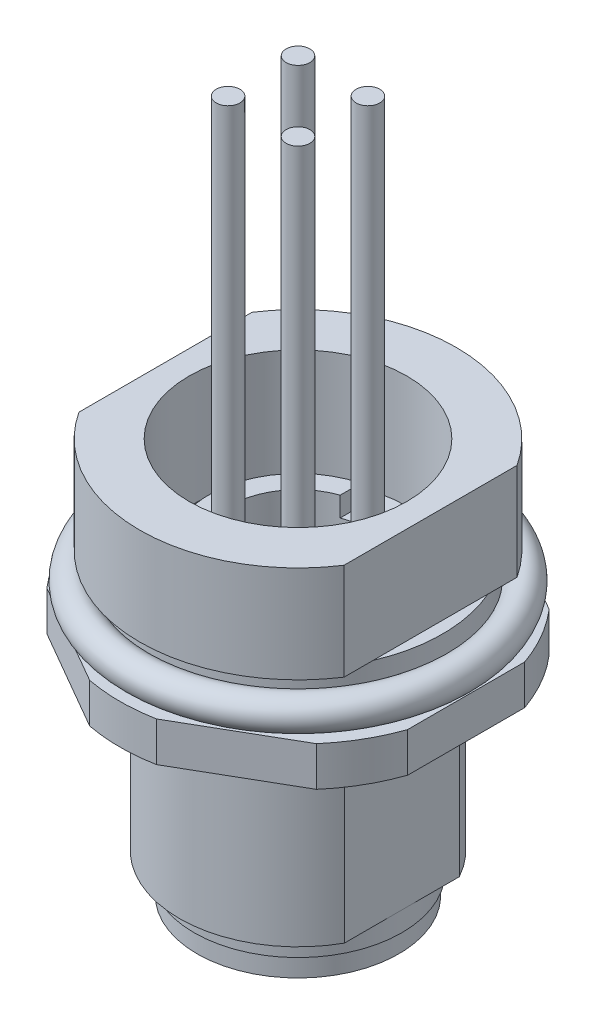
from build123d import *
from build123d.topology import SkipClean

# Parameters (mm, degrees)
BOSS_EXTRUDE2_DEPTH                     = 4.9
BOSS_EXTRUDE3_DEPTH                     = 2
BOSS_EXTRUDE4_DEPTH                     = 9
BOSS_EXTRUDE5_REACH                     = 24.83
SKETCH5_R                               = 5.25
SKETCH6_R                               = 5.1
BOSS_EXTRUDE6_DEPTH                     = 1
F_8_3_8_3_DIAMETER_HOLE1_D              = 8.3
F_8_3_8_3_DIAMETER_HOLE1_DEPTH          = 8
BOSS_EXTRUDE7_DEPTH                     = 7.5
CUT_EXTRUDE1_START                      = -1
CUT_EXTRUDE1_DEPTH                      = 1
CBORE_FOR_M6_HEX_HEAD_BOLT1_D           = 7
CBORE_FOR_M6_HEX_HEAD_BOLT1_DEPTH       = 8.2
CBORE_FOR_M6_HEX_HEAD_BOLT1_CBORE_D     = 11
CBORE_FOR_M6_HEX_HEAD_BOLT1_CBORE_DEPTH = 5.7
BOSS_EXTRUDE8_DEPTH                     = 1
BOSS_EXTRUDE9_DEPTH                     = 1
BOSS_EXTRUDE10_DEPTH                    = 1
BOSS_EXTRUDE14_DEPTH                    = 1
SKETCH21_W                              = 0.6
SKETCH21_H                              = 23.2
SKETCH22_W                              = 0.6
SKETCH22_H                              = 23.2
SKETCH23_W                              = 0.6
SKETCH23_H                              = 23.2
SKETCH24_W                              = 0.6
SKETCH24_H                              = 23.2
FILLET1_R                               = 1.2


with BuildPart() as part:
    # Boss-Extrude1: read off the stored shape, not the designer's step
    # Boss-Extrude1 outline → Boss-Extrude1 (revolve)
    with BuildSketch(Plane.XY):
        with BuildLine():
            ThreePointArc((8.1, 4), (8.665685425, 5.365685425), (7.3, 4.8))
            Line((7.3, 4.8), (7.3, 6.1))
            Line((7.3, 6.1), (0, 6.1))
            Line((0, 6.1), (0, 4))
            Line((0, 4), (8.1, 4))
        make_face()
    revolve(axis=Axis((0, 0, 0), (0, 1, 0)))

    # Sketch2 → Boss-Extrude2 (add)
    with BuildSketch(Plane(origin=(0, 6.1, 0), x_dir=(-1, 0, 0), z_dir=(0, 1, 0))):
        with BuildLine():
            Line((-6.7, -4.371498599), (-6.7, 4.371498599))
            ThreePointArc((-6.7, 4.371498599), (0, 8), (6.7, 4.371498599))
            Line((6.7, 4.371498599), (6.7, -4.371498599))
            ThreePointArc((6.7, -4.371498599), (0, -8), (-6.7, -4.371498599))
        make_face()
    extrude(amount=BOSS_EXTRUDE2_DEPTH)

    # Sketch3 → Boss-Extrude3 (add)
    with BuildSketch(Plane(origin=(0, 4, 0), x_dir=(1, 0, 0), z_dir=(0, 1, 0))):
        with BuildLine():
            Line((1.688262309, -8.840235878), (6.811737691, -5.882195986))
            ThreePointArc((6.811737691, -5.882195986), (7.794228634, -4.5), (8.5, -2.958039892))
            Line((8.5, -2.958039892), (8.5, 2.958039892))
            ThreePointArc((8.5, 2.958039892), (7.794228634, 4.5), (6.811737691, 5.882195986))
            Line((6.811737691, 5.882195986), (1.688262309, 8.840235878))
            ThreePointArc((1.688262309, 8.840235878), (0, 9), (-1.688262309, 8.840235878))
            Line((-1.688262309, 8.840235878), (-6.811737691, 5.882195986))
            ThreePointArc((-6.811737691, 5.882195986), (-7.794228634, 4.5), (-8.5, 2.958039892))
            Line((-8.5, 2.958039892), (-8.5, -2.958039892))
            ThreePointArc((-8.5, -2.958039892), (-7.794228634, -4.5), (-6.811737691, -5.882195986))
            Line((-6.811737691, -5.882195986), (-1.688262309, -8.840235878))
            ThreePointArc((-1.688262309, -8.840235878), (0, -9), (1.688262309, -8.840235878))
        make_face()
    extrude(amount=-BOSS_EXTRUDE3_DEPTH)

    # Sketch4 → Boss-Extrude4 (add)
    with BuildSketch(Plane.XZ.offset(-2)):
        with BuildLine():
            Line((-5.25, -2.90473751), (-5.25, 2.90473751))
            ThreePointArc((-5.25, 2.90473751), (0, 6), (5.25, 2.90473751))
            Line((5.25, 2.90473751), (5.25, -2.90473751))
            ThreePointArc((5.25, -2.90473751), (0, -6), (-5.25, -2.90473751))
        make_face()
    extrude(amount=BOSS_EXTRUDE4_DEPTH)

    # Sketch5 → Boss-Extrude5 (add, up to next)
    with BuildSketch(Plane.XZ.offset(8), mode=Mode.PRIVATE) as boss_extrude5_sk1:
        Circle(SKETCH5_R)
    boss_extrude5_tool1 = extrude(boss_extrude5_sk1.sketch, amount=-BOSS_EXTRUDE5_REACH, mode=Mode.PRIVATE) - part.part
    add(boss_extrude5_tool1.solids().sort_by_distance((0, -8, 0))[0])

    # Sketch6 → Boss-Extrude6 (add)
    with BuildSketch(Plane.XZ.offset(8)):
        with Locations(Location((0, 0, 0), (0, 0, 90))):
            Circle(SKETCH6_R)
    extrude(amount=BOSS_EXTRUDE6_DEPTH)

    # Ø8.3 (8.3) Diameter Hole1
    with Locations(Plane(origin=(0, -9, 0), x_dir=(-1, 0, 0), z_dir=(0, -1, 0))):
        with Locations((0, 0)):
            Hole(F_8_3_8_3_DIAMETER_HOLE1_D / 2, depth=F_8_3_8_3_DIAMETER_HOLE1_DEPTH)

    # Sketch9 → Boss-Extrude7 (add)
    with BuildSketch(Plane.XZ.offset(1)):
        with BuildLine():
            Line((-0.65, 3.3), (-0.65, 4.098780306))
            ThreePointArc((-0.65, 4.098780306), (0, 4.15), (0.65, 4.098780306))
            Line((0.65, 4.098780306), (0.65, 3.3))
            ThreePointArc((0.65, 3.3), (0, 2.65), (-0.65, 3.3))
        make_face()
    extrude(amount=BOSS_EXTRUDE7_DEPTH)

    # Sketch10 → Cut-Extrude1 (cut)
    with SkipClean():  # the faces are left unmerged after this step: merging them gives an invalid solid
        with BuildSketch(Plane.XZ.offset(1).offset(CUT_EXTRUDE1_START)):
            with BuildLine():
                Line((-0.65, 0.65), (-4.098780306, 0.65))
                ThreePointArc((-4.098780306, 0.65), (0, -4.15), (4.098780306, 0.65))
                Line((4.098780306, 0.65), (0.65, 0.65))
                Line((0.65, 0.65), (0.65, 3.3))
                ThreePointArc((0.65, 3.3), (0, 2.65), (-0.65, 3.3))
                Line((-0.65, 3.3), (-0.65, 0.65))
            make_face()
        extrude(amount=CUT_EXTRUDE1_DEPTH, mode=Mode.SUBTRACT)

    # CBORE for M6 Hex Head Bolt1
    with Locations(Plane(origin=(0, 11, 0), x_dir=(1, 0, 0), z_dir=(0, 1, 0))):
        with Locations((0, 0)):
            CounterBoreHole(CBORE_FOR_M6_HEX_HEAD_BOLT1_D / 2, CBORE_FOR_M6_HEX_HEAD_BOLT1_CBORE_D / 2, CBORE_FOR_M6_HEX_HEAD_BOLT1_CBORE_DEPTH, depth=CBORE_FOR_M6_HEX_HEAD_BOLT1_DEPTH)

    # Sketch13 → Boss-Extrude8 (add)
    with BuildSketch(Plane(origin=(0, 5.3, 0), x_dir=(-1, 0, 0), z_dir=(0, 1, 0))):
        with BuildLine():
            Line((-1.166190379, 4.346262762), (-1.166190379, 3.3))
            ThreePointArc((-1.166190379, 3.3), (-3.5, 0), (-1.166190379, -3.3))
            Line((-1.166190379, -3.3), (-1.166190379, -4.346262762))
            ThreePointArc((-1.166190379, -4.346262762), (-4.5, 0), (-1.166190379, 4.346262762))
        make_face()
    extrude(amount=BOSS_EXTRUDE8_DEPTH)

    # Sketch14 → Boss-Extrude9 (add)
    with SkipClean():  # the faces are left unmerged after this step: merging them gives an invalid solid
        with BuildSketch(Plane(origin=(0, 5.3, 0), x_dir=(-1, 0, 0), z_dir=(0, 1, 0))):
            with BuildLine():
                Line((1.166190379, -4.346262762), (1.166190379, -3.3))
                ThreePointArc((1.166190379, -3.3), (3.5, 0), (1.166190379, 3.3))
                Line((1.166190379, 3.3), (1.166190379, 4.346262762))
                ThreePointArc((1.166190379, 4.346262762), (4.5, 0), (1.166190379, -4.346262762))
            make_face()
        extrude(amount=BOSS_EXTRUDE9_DEPTH)
    add(part.part.scale(1), mode=Mode.REPLACE)  # the faces are merged on a copy

    # Sketch15 → Boss-Extrude10 (add)
    with BuildSketch(Plane.XZ):
        with BuildLine():
            Line((0.65, -0.65), (4.098780306, -0.65))
            ThreePointArc((4.098780306, -0.65), (2.934493142, -2.934493142), (0.65, -4.098780306))
            Line((0.65, -4.098780306), (0.65, -0.65))
        make_face()
    extrude(amount=BOSS_EXTRUDE10_DEPTH)

    # Boss-Extrude11: read off the stored shape, not the designer's step
    # Boss-Extrude11 outline → Boss-Extrude11 (revolve)
    with BuildSketch(Plane(origin=(1.767766953, 0, -1.767766953), x_dir=(1, 0, 0), z_dir=(0, 0, 1))):
        with BuildLine():
            Line((0, -1), (0, -8))
            ThreePointArc((0, -8), (0.353553391, -7.853553391), (0.5, -7.5))
            Line((0.5, -7.5), (0.5, -1))
            Line((0.5, -1), (0, -1))
        make_face()
    revolve(axis=Axis((1.767766953, 0, -1.767766953), (0, 1, 0)))

    # Boss-Extrude12: read off the stored shape, not the designer's step
    # Boss-Extrude12 outline → Boss-Extrude12 (revolve)
    with BuildSketch(Plane(origin=(1.767766953, 0, 1.767766953), x_dir=(1, 0, 0), z_dir=(0, 0, 1))):
        with BuildLine():
            Line((0, -1), (0, -8))
            ThreePointArc((0, -8), (0.353553391, -7.853553391), (0.5, -7.5))
            Line((0.5, -7.5), (0.5, -1))
            Line((0.5, -1), (0, -1))
        make_face()
    revolve(axis=Axis((1.767766953, 0, 1.767766953), (0, 1, 0)))

    # Boss-Extrude13: read off the stored shape, not the designer's step
    # Boss-Extrude13 outline → Boss-Extrude13 (revolve)
    with BuildSketch(Plane(origin=(-1.767766953, 0, 1.767766953), x_dir=(1, 0, 0), z_dir=(0, 0, 1))):
        with BuildLine():
            Line((0, -1), (0, -8))
            ThreePointArc((0, -8), (0.353553391, -7.853553391), (0.5, -7.5))
            Line((0.5, -7.5), (0.5, -1))
            Line((0.5, -1), (0, -1))
        make_face()
    revolve(axis=Axis((-1.767766953, 0, 1.767766953), (0, 1, 0)))

    # Sketch19 → Boss-Extrude14 (add)
    with BuildSketch(Plane.XZ):
        with BuildLine():
            Line((-0.65, -0.65), (-0.65, -4.098780306))
            ThreePointArc((-0.65, -4.098780306), (-2.934493142, -2.934493142), (-4.098780306, -0.65))
            Line((-4.098780306, -0.65), (-0.65, -0.65))
        make_face()
    extrude(amount=BOSS_EXTRUDE14_DEPTH)

    # Boss-Extrude15: read off the stored shape, not the designer's step
    # Boss-Extrude15 outline → Boss-Extrude15 (revolve)
    with BuildSketch(Plane(origin=(-1.767766953, 0, -1.767766953), x_dir=(1, 0, 0), z_dir=(0, 0, 1))):
        with BuildLine():
            Line((0, -1), (0, -8))
            ThreePointArc((0, -8), (0.353553391, -7.853553391), (0.5, -7.5))
            Line((0.5, -7.5), (0.5, -1))
            Line((0.5, -1), (0, -1))
        make_face()
    revolve(axis=Axis((-1.767766953, 0, -1.767766953), (0, 1, 0)))

    # Sketch21 → Revolve1 (revolve)
    with BuildSketch(Plane(origin=(0, 0, 1.767766953), x_dir=(-1, 0, 0), z_dir=(0, 0, -1)), mode=Mode.PRIVATE) as revolve1_sk:
        with Locations((1.467766953, 14.4)):
            Rectangle(SKETCH21_W, SKETCH21_H)
    revolve(revolve1_sk.sketch.rotate(Axis((-1.767766953, 2.8, 1.767766953), (0, 1, 0)), 270), axis=Axis((-1.767766953, 2.8, 1.767766953), (0, 1, 0)))

    # Sketch22 → Revolve2 (revolve)
    with BuildSketch(Plane(origin=(0, 0, 1.767766953), x_dir=(-1, 0, 0), z_dir=(0, 0, -1)), mode=Mode.PRIVATE) as revolve2_sk:
        with Locations((-2.067766953, 14.4)):
            Rectangle(SKETCH22_W, SKETCH22_H)
    revolve(revolve2_sk.sketch.rotate(Axis((1.767766953, 2.8, 1.767766953), (0, 1, 0)), 270), axis=Axis((1.767766953, 2.8, 1.767766953), (0, 1, 0)))

    # Sketch23 → Revolve3 (revolve)
    with BuildSketch(Plane(origin=(0, 0, -1.767766953), x_dir=(-1, 0, 0), z_dir=(0, 0, -1)), mode=Mode.PRIVATE) as revolve3_sk:
        with Locations((-2.067766953, 14.4)):
            Rectangle(SKETCH23_W, SKETCH23_H)
    revolve(revolve3_sk.sketch.rotate(Axis((1.767766953, 2.8, -1.767766953), (0, 1, 0)), 270), axis=Axis((1.767766953, 2.8, -1.767766953), (0, 1, 0)))

    # Sketch24 → Revolve4 (revolve)
    with BuildSketch(Plane(origin=(0, 0, -1.767766953), x_dir=(-1, 0, 0), z_dir=(0, 0, -1)), mode=Mode.PRIVATE) as revolve4_sk:
        with Locations((1.467766953, 14.4)):
            Rectangle(SKETCH24_W, SKETCH24_H)
    revolve(revolve4_sk.sketch.rotate(Axis((-1.767766953, 2.8, -1.767766953), (0, 1, 0)), 270), axis=Axis((-1.767766953, 2.8, -1.767766953), (0, 1, 0)))

    # Fillet1
    fillet1_edges = [part.edges().sort_by_distance(p)[0] for p in [
        (-0.65, -0.5, -0.65),
        (-0.65, -0.5, 0.65),
        (0.65, -0.5, -0.65),
        (0.65, -0.5, 0.65),
    ]]
    fillet(fillet1_edges, radius=FILLET1_R)


solid = part.part
